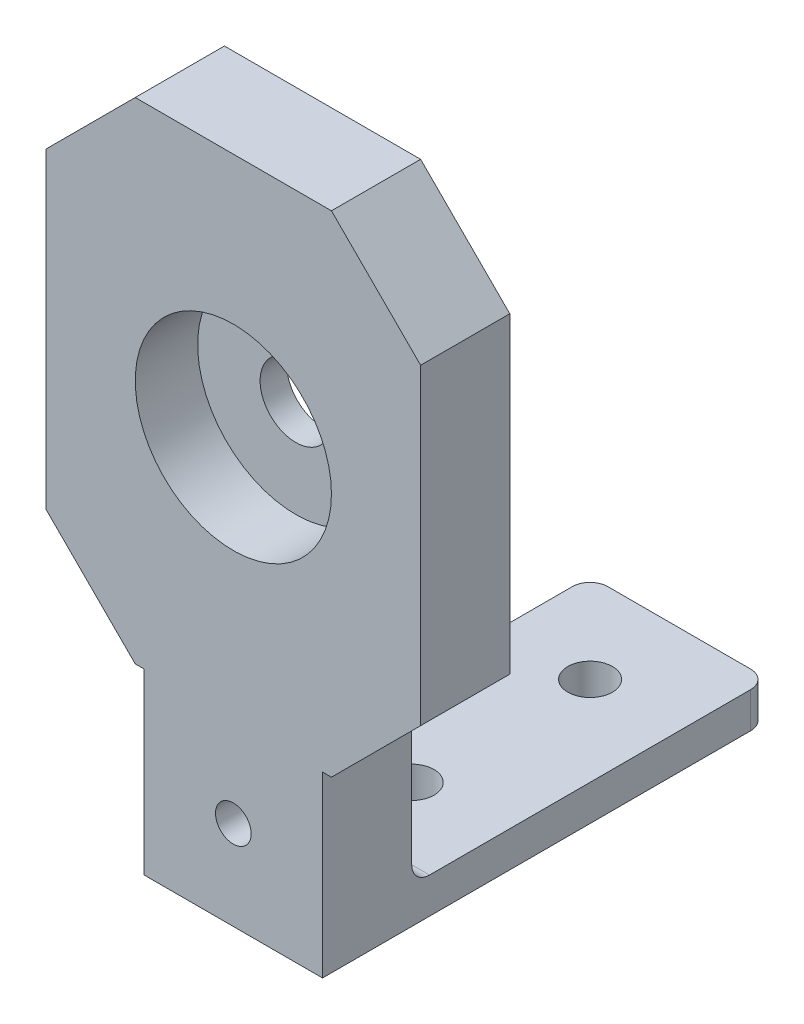
from build123d import *

# Parameters (mm, degrees)
ESTRUSIONE_ESTRUSIONE1_DEPTH = 10
SCHIZZO6_R                   = 11
TAGLIO_ESTRUSIONE4_DEPTH     = 7
SCHIZZO7_R                   = 4
TAGLIO_ESTRUSIONE5_DEPTH     = 53.404675364
SMUSSO2_SIZE                 = 10
SCHIZZO8_W                   = 20
SCHIZZO8_H                   = 4
ESTRUSIONE_ESTRUSIONE3_DEPTH = 40
SCHIZZO9_R                   = 2.5
TAGLIO_ESTRUSIONE6_DEPTH     = 35
RACCORDO1_R                  = 2
SCHIZZO10_R                  = 2
TAGLIO_ESTRUSIONE7_DEPTH     = 10


with BuildPart() as part:
    # Schizzo1 → Estrusione-Estrusione1 (new body)
    with BuildSketch(Plane.XY):
        Polygon((-10, -47.5), (10, -47.5), (10, -27.5), (21, -27.5), (21, 27.5), (-21, 27.5), (-21, -27.5), (-10, -27.5), align=None)
    extrude(amount=ESTRUSIONE_ESTRUSIONE1_DEPTH)

    # Schizzo6 → Taglio-Estrusione4 (cut)
    with BuildSketch(Plane.XY.offset(10)):
        Circle(SCHIZZO6_R)
    extrude(amount=-TAGLIO_ESTRUSIONE4_DEPTH, mode=Mode.SUBTRACT)

    # Schizzo7 → Taglio-Estrusione5 (cut, through all)
    with BuildSketch(Plane.XY.offset(3)):
        Circle(SCHIZZO7_R)
    extrude(amount=-TAGLIO_ESTRUSIONE5_DEPTH, mode=Mode.SUBTRACT)

    # Smusso2
    smusso2_edges = [part.edges().sort_by_distance(p)[0] for p in [
        (-21, -27.5, 5),
        (21, -27.5, 5),
        (21, 27.5, 5),
        (-21, 27.5, 5),
    ]]
    chamfer(smusso2_edges, length=SMUSSO2_SIZE)

    # Schizzo8 → Estrusione-Estrusione3 (add)
    with BuildSketch(Plane(origin=(0, 0, 0), x_dir=(-1, 0, 0), z_dir=(0, 0, -1))):
        with Locations((0, -45.5)):
            Rectangle(SCHIZZO8_W, SCHIZZO8_H)
    extrude(amount=ESTRUSIONE_ESTRUSIONE3_DEPTH)

    # Schizzo9 → Taglio-Estrusione6 (cut)
    with BuildSketch(Plane(origin=(0, -43.5, 0), x_dir=(1, 0, 0), z_dir=(0, 1, 0))):
        with Locations((0, 10)):
            Circle(SCHIZZO9_R)
        with Locations((0, 30)):
            Circle(SCHIZZO9_R)
    extrude(amount=-TAGLIO_ESTRUSIONE6_DEPTH, mode=Mode.SUBTRACT)

    # Raccordo1
    raccordo1_edges = [part.edges().sort_by_distance(p)[0] for p in [
        (0, -43.5, 0),
        (-10, -45.5, -40),
        (10, -45.5, -40),
    ]]
    fillet(raccordo1_edges, radius=RACCORDO1_R)

    # Schizzo10 → Taglio-Estrusione7 (cut)
    with BuildSketch(Plane(origin=(0, 0, 0), x_dir=(-1, 0, 0), z_dir=(0, 0, -1))):
        with Locations((0, -37.5)):
            Circle(SCHIZZO10_R)
    extrude(amount=-TAGLIO_ESTRUSIONE7_DEPTH, mode=Mode.SUBTRACT)


solid = part.part
